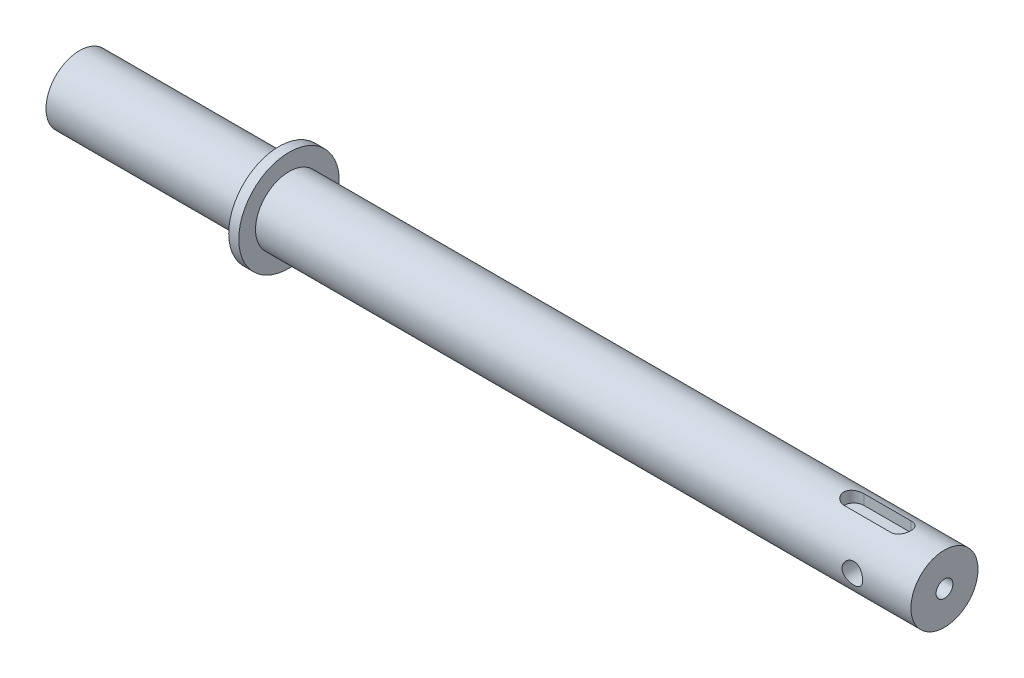
from build123d import *

# Parameters (mm, degrees)
SALIENTE_EXTRUIR1_START           = 8
CROQUIS1_R                        = 10
SALIENTE_EXTRUIR1_DEPTH           = 258
CROQUIS2_R                        = 15
SALIENTE_EXTRUIR2_DEPTH           = 3
CORTAR_EXTRUIR1_REACH             = 268.845
CROQUIS3_R                        = 3.075
CORTAR_EXTRUIR1_DIRECTION_2_REACH = 268.845
CORTAR_EXTRUIR2_START             = 10
CORTAR_EXTRUIR2_DEPTH             = 3.5
TALADRO_ROSCADO_M61_D             = 5
TALADRO_ROSCADO_M61_DEPTH         = 11.497848452
TALADRO_ROSCADO_M61_TIP           = 1.502151548


with BuildPart() as part:
    # Croquis1 → Saliente-Extruir1 (new body)
    with BuildSketch(Plane(origin=(0, 0, 0), x_dir=(0, 0, -1), z_dir=(1, 0, 0)).offset(SALIENTE_EXTRUIR1_START)):
        Circle(CROQUIS1_R)
    extrude(amount=SALIENTE_EXTRUIR1_DEPTH)

    # Croquis2 → Saliente-Extruir2 (add)
    with BuildSketch(Plane.ZY.offset(-70.5)):
        Circle(CROQUIS2_R)
    extrude(amount=SALIENTE_EXTRUIR2_DEPTH)

    # Croquis3 → Cortar-Extruir1 (cut, up to next)
    with BuildSketch(Plane.XY, mode=Mode.PRIVATE) as cortar_extruir1_sk1:
        with Locations((248.5, 0)):
            Circle(CROQUIS3_R)
    cortar_extruir1_tool1 = extrude(cortar_extruir1_sk1.sketch, amount=-CORTAR_EXTRUIR1_REACH, mode=Mode.PRIVATE) & part.part
    add(cortar_extruir1_tool1.solids().sort_by_distance((248.5, 0, 0))[0], mode=Mode.SUBTRACT)

    # Croquis3 → Cortar-Extruir1 direction 2 (cut, up to next)
    with BuildSketch(Plane.XY, mode=Mode.PRIVATE) as cortar_extruir1_direction_2_sk1:
        with Locations((248.5, 0)):
            Circle(CROQUIS3_R)
    cortar_extruir1_direction_2_tool1 = extrude(cortar_extruir1_direction_2_sk1.sketch, amount=CORTAR_EXTRUIR1_DIRECTION_2_REACH, mode=Mode.PRIVATE) & part.part
    add(cortar_extruir1_direction_2_tool1.solids().sort_by_distance((248.5, 0, 0))[0], mode=Mode.SUBTRACT)

    # Croquis4 → Cortar-Extruir2 (cut)
    with BuildSketch(Plane(origin=(0, 0, 0), x_dir=(1, 0, 0), z_dir=(0, 1, 0)).offset(CORTAR_EXTRUIR2_START)):
        with BuildLine():
            Line((239, 3), (253, 3))
            ThreePointArc((253, 3), (256, 0), (253, -3))
            Line((253, -3), (239, -3))
            ThreePointArc((239, -3), (236, 0), (239, 3))
        make_face()
    extrude(amount=-CORTAR_EXTRUIR2_DEPTH, mode=Mode.SUBTRACT)

    # Taladro roscado M61
    with Locations(Plane(origin=(266, 0, 0), x_dir=(0, 0, 1), z_dir=(1, 0, 0))):
        with Locations((0, 0)):
            Hole(TALADRO_ROSCADO_M61_D / 2, depth=TALADRO_ROSCADO_M61_DEPTH)
            with Locations((0, 0, -(TALADRO_ROSCADO_M61_DEPTH + TALADRO_ROSCADO_M61_TIP / 2))):  # 118° drill point
                Cone(0, TALADRO_ROSCADO_M61_D / 2, TALADRO_ROSCADO_M61_TIP, mode=Mode.SUBTRACT)


solid = part.part
